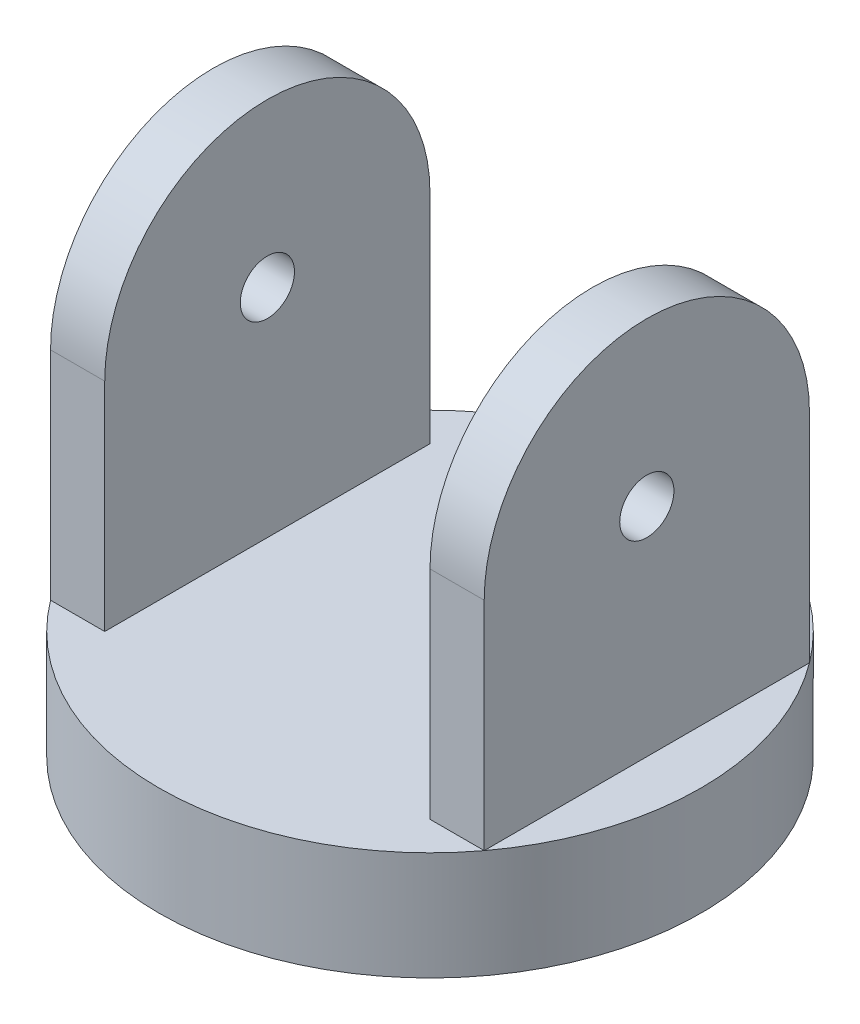
from build123d import *

# Parameters (mm, degrees)
SKETCH1_R           = 25
BOSS_EXTRUDE1_DEPTH = 10
SKETCH2_W           = 5
SKETCH2_H           = 30
BOSS_EXTRUDE2_DEPTH = 40
SKETCH3_R           = 2.5
CUT_EXTRUDE1_DEPTH  = 72.763500472


with BuildPart() as part:
    # Sketch1 → Boss-Extrude1 (new body)
    with BuildSketch(Plane(origin=(0, 0, 0), x_dir=(1, 0, 0), z_dir=(0, 1, 0))):
        Circle(SKETCH1_R)
    extrude(amount=BOSS_EXTRUDE1_DEPTH)

    # Sketch2 → Boss-Extrude2 (add)
    with BuildSketch(Plane(origin=(0, 10, 0), x_dir=(1, 0, 0), z_dir=(0, 1, 0))):
        with Locations((17.5, 0)):
            Rectangle(SKETCH2_W, SKETCH2_H)
        with Locations((-17.5, 0)):
            Rectangle(SKETCH2_W, SKETCH2_H)
    extrude(amount=BOSS_EXTRUDE2_DEPTH)

    # Sketch3 → Cut-Extrude1 (cut, through all)
    with BuildSketch(Plane.ZY.offset(20)):
        with BuildLine():
            Line((-15, 50), (-15, 30))
            ThreePointArc((-15, 30), (0, 45), (15, 30))
            Line((15, 30), (15, 50))
            Line((15, 50), (-15, 50))
        make_face()
        with Locations((0, 30)):
            Circle(SKETCH3_R)
    extrude(amount=-CUT_EXTRUDE1_DEPTH, mode=Mode.SUBTRACT)


solid = part.part
